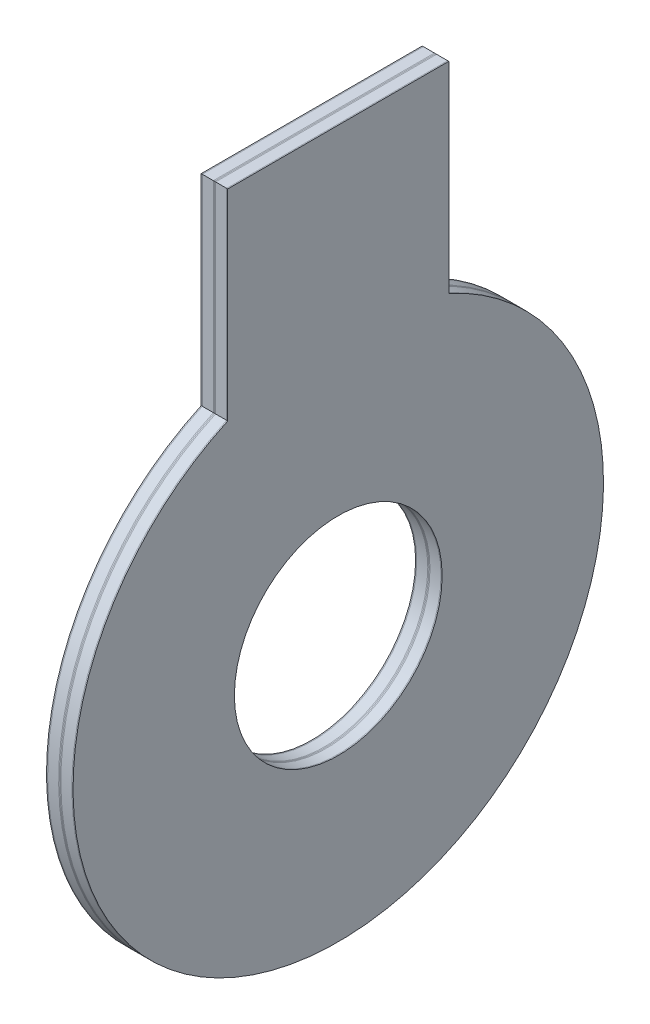
from build123d import *

# Parameters (mm, degrees)
SKETCH1_R            = 23.5
BOSS_EXTRUDE1_DEPTH  = 0.25
SKETCH4_R            = 23.5
BOSS_EXTRUDE4_DEPTH  = 2.5
SKETCH5_R            = 23.5
BOSS_EXTRUDE5_DEPTH  = 0.25
SKETCH10_R           = 23.5
BOSS_EXTRUDE9_DEPTH  = 0.25
SKETCH11_R           = 23.5
BOSS_EXTRUDE10_DEPTH = 2.5
SKETCH13_R           = 23.5
BOSS_EXTRUDE11_DEPTH = 0.25


with BuildPart() as part:
    # Sketch1 → Boss-Extrude1 (new body)
    with BuildSketch(Plane(origin=(0, 0, 0), x_dir=(0, 0, -1), z_dir=(1, 0, 0))):
        with BuildLine():
            Line((25, 100), (-25, 100))
            Line((-25, 100), (-25, 54.543560573))
            ThreePointArc((-25, 54.543560573), (0, -60), (25, 54.543560573))
            Line((25, 54.543560573), (25, 100))
        make_face()
        Circle(SKETCH1_R, mode=Mode.SUBTRACT)
    extrude(amount=BOSS_EXTRUDE1_DEPTH)


with BuildPart() as body_2:
    # Sketch4 → Boss-Extrude4 (new body)
    with BuildSketch(Plane.ZY):
        with BuildLine():
            Line((25, 54.543560573), (25, 100))
            Line((25, 100), (-25, 100))
            Line((-25, 100), (-25, 54.543560573))
            ThreePointArc((-25, 54.543560573), (0, -60), (25, 54.543560573))
        make_face()
        Circle(SKETCH4_R, mode=Mode.SUBTRACT)
    extrude(amount=BOSS_EXTRUDE4_DEPTH)


with BuildPart() as body_3:
    # Sketch5 → Boss-Extrude5 (new body)
    with BuildSketch(Plane.ZY.offset(2.5)):
        with BuildLine():
            Line((25, 54.543560573), (25, 100))
            Line((25, 100), (-25, 100))
            Line((-25, 100), (-25, 54.543560573))
            ThreePointArc((-25, 54.543560573), (0, -60), (25, 54.543560573))
        make_face()
        Circle(SKETCH5_R, mode=Mode.SUBTRACT)
    extrude(amount=BOSS_EXTRUDE5_DEPTH)


with BuildPart() as body_4:
    # Sketch10 → Boss-Extrude9 (new body)
    with BuildSketch(Plane.ZY.offset(2.75)):
        with BuildLine():
            Line((-25, 100), (-25, 54.543560573))
            ThreePointArc((-25, 54.543560573), (0, -60), (25, 54.543560573))
            Line((25, 54.543560573), (25, 100))
            Line((25, 100), (-25, 100))
        make_face()
        Circle(SKETCH10_R, mode=Mode.SUBTRACT)
    extrude(amount=BOSS_EXTRUDE9_DEPTH)


with BuildPart() as body_5:
    # Sketch11 → Boss-Extrude10 (new body)
    with BuildSketch(Plane.ZY.offset(3)):
        with BuildLine():
            Line((25, 100), (-25, 100))
            Line((-25, 100), (-25, 54.543560573))
            ThreePointArc((-25, 54.543560573), (0, -60), (25, 54.543560573))
            Line((25, 54.543560573), (25, 100))
        make_face()
        Circle(SKETCH11_R, mode=Mode.SUBTRACT)
    extrude(amount=BOSS_EXTRUDE10_DEPTH)


with BuildPart() as body_6:
    # Sketch13 → Boss-Extrude11 (new body)
    with BuildSketch(Plane.ZY.offset(5.5)):
        with BuildLine():
            Line((25, 54.543560573), (25, 100))
            Line((25, 100), (-25, 100))
            Line((-25, 100), (-25, 54.543560573))
            ThreePointArc((-25, 54.543560573), (0, -60), (25, 54.543560573))
        make_face()
        Circle(SKETCH13_R, mode=Mode.SUBTRACT)
    extrude(amount=BOSS_EXTRUDE11_DEPTH)


solid = Compound([part.part, body_2.part, body_3.part, body_4.part, body_5.part, body_6.part])
